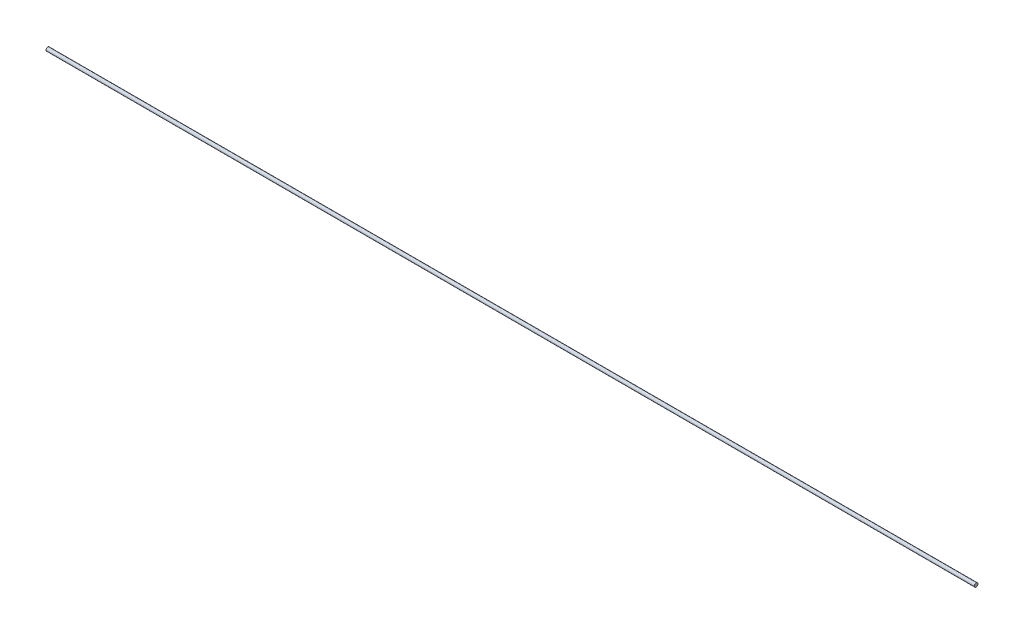
from build123d import *

# Parameters (mm, degrees)
SKETCH1_R           = 3.175
BOSS_EXTRUDE1_DEPTH = 1651


with BuildPart() as part:
    # Sketch1 → Boss-Extrude1 (new body)
    with BuildSketch(Plane(origin=(0, 0, 0), x_dir=(0, 0, -1), z_dir=(1, 0, 0))):
        Circle(SKETCH1_R)
    extrude(amount=BOSS_EXTRUDE1_DEPTH)


solid = part.part
